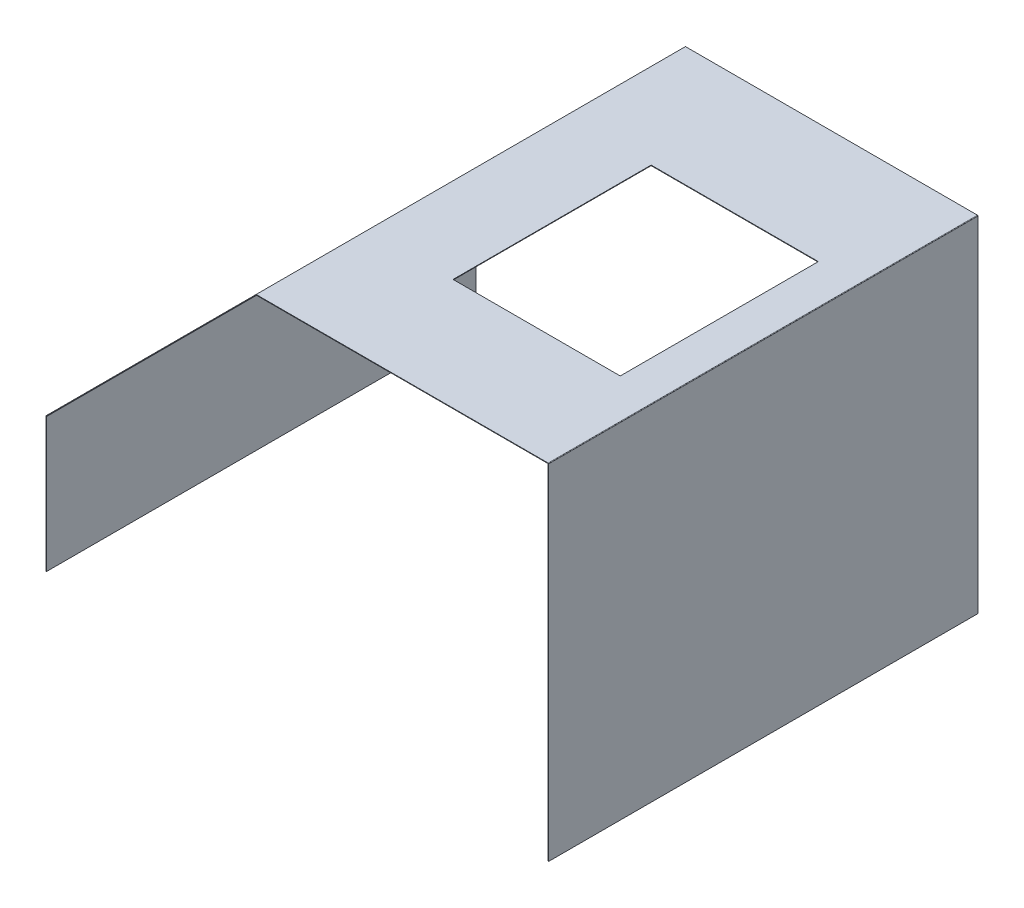
from build123d import *

# Parameters (mm, degrees)
SALIENTE_EXTRUIR1_DEPTH    = 0.83566
SALIENTE_EXTRUIR2_DEPTH    = 12.7
SALIENTE_EXTRUIR3_DEPTH    = 642.126
CROQUIS4_W                 = 255
CROQUIS4_H                 = 0.83566
SALIENTE_EXTRUIR4_DEPTH    = 170
CROQUIS5_W                 = 255
CROQUIS5_H                 = 0.83566
SALIENTE_EXTRUIR5_DEPTH    = 170
CROQUIS6_W                 = 570
CROQUIS6_H                 = 401.24062337
CORTAR_EXTRUIR1_DEPTH      = 190
CORTAR_EXTRUIR2_DEPTH      = 198
CORTAR_EXTRUIR2_DEPTH_BACK = 174
REDONDEO3_R                = 0.8


with BuildPart() as part:
    # Croquis1 → Saliente-Extruir1 (new body)
    with BuildSketch(Plane.XY):
        Polygon((0, 0), (765, 0), (765, 525), (320, 525), (0, 205), align=None)
    extrude(amount=SALIENTE_EXTRUIR1_DEPTH)

    # Croquis7 → Cortar-Extruir2 (cut, two sides: drawn at the far end of the back side and taken through both)
    with BuildSketch(Plane.XY.offset(0.83566).offset(-CORTAR_EXTRUIR2_DEPTH_BACK)):
        Polygon((0, 0), (765, 0), (765, 525), (320, 525), (0, 205), align=None)
    extrude(amount=CORTAR_EXTRUIR2_DEPTH + CORTAR_EXTRUIR2_DEPTH_BACK, mode=Mode.SUBTRACT)


with BuildPart() as body_2:
    # Croquis2 → Saliente-Extruir2 (new body)
    with BuildSketch(Plane.XY.offset(0.83566)):
        Polygon((765.83566, 525.83566), (319.653858294, 525.83566), (-0.83566, 205.346141706), (-0.83566, 0), (0, 0), (0, 205), (320, 525), (765, 525), (765, 0), (765.83566, 0), align=None)
    extrude(amount=SALIENTE_EXTRUIR2_DEPTH)

    # Croquis3 → Saliente-Extruir3 (add)
    with BuildSketch(Plane.XY.offset(13.53566)):
        Polygon((450, 525.83566), (450, 525), (320, 525), (0, 205), (0, 0), (-0.83566, 0), (-0.83566, 205.346141706), (319.653858294, 525.83566), align=None)
        Polygon((765.83566, 0), (765.83566, 525.83566), (705, 525.83566), (705, 525), (765, 525), (765, 0), align=None)
    extrude(amount=SALIENTE_EXTRUIR3_DEPTH)

    # Croquis4 → Saliente-Extruir4 (add)
    with BuildSketch(Plane.XY.offset(13.53566)):
        with Locations((577.5, 525.41783)):
            Rectangle(CROQUIS4_W, CROQUIS4_H)
    extrude(amount=SALIENTE_EXTRUIR4_DEPTH)

    # Croquis5 → Saliente-Extruir5 (add)
    with BuildSketch(Plane.XY.offset(655.66166)):
        with Locations((577.5, 525.41783)):
            Rectangle(CROQUIS5_W, CROQUIS5_H)
    extrude(amount=-SALIENTE_EXTRUIR5_DEPTH)

    # Croquis6 → Cortar-Extruir1 (cut)
    with BuildSketch(Plane(origin=(-103.090900853, 103.090900853, 0), x_dir=(0, 0, 1), z_dir=(-0.7071067811865477, 0.7071067811865475, 0))):
        with Locations((328.24866, 397.231060123)):
            Rectangle(CROQUIS6_W, CROQUIS6_H)
    extrude(amount=-CORTAR_EXTRUIR1_DEPTH, mode=Mode.SUBTRACT)

    # Redondeo3
    redondeo3_edges = [body_2.edges().sort_by_distance(p)[0] for p in [
        (765.83566, 525.83566, 328.24866),
        (765, 525, 328.24866),
        (0, 205, 328.24866),
        (-0.83566, 205.346141706, 328.24866),
    ]]
    fillet(redondeo3_edges, radius=REDONDEO3_R)


solid = body_2.part
